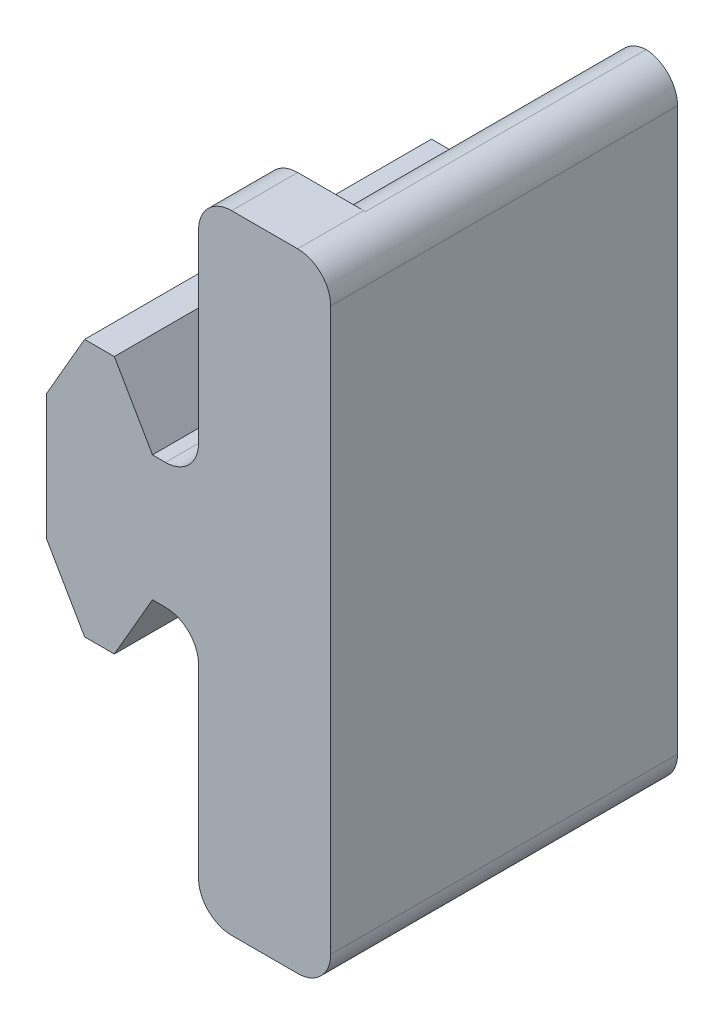
from build123d import *

# Parameters (mm, degrees)
SALIENTE_EXTRUIR1_DEPTH = 21
CROQUIS3_W              = 4.2
CROQUIS3_H              = 38
CORTAR_EXTRUIR1_DEPTH   = 17
REDONDEO1_R             = 2


with BuildPart() as part:
    # Croquis1 → Saliente-Extruir1 (new body)
    with BuildSketch(Plane(origin=(0, 0, 0), x_dir=(0, 1, 0), z_dir=(0, 0, 1))):
        Polygon((-3.8, 9.209401077), (3.8, 9.209401077), (7.8, 6.9), (7.8, 5.1), (3.8, 2.790598923), (3.8, 0), (19, 0), (19, -8), (-19, -8), (-19, 0), (-3.8, 0), (-3.8, 2.790598923), (-7.8, 5.1), (-7.8, 6.9), align=None)
    extrude(amount=SALIENTE_EXTRUIR1_DEPTH)

    # Croquis3 → Cortar-Extruir1 (cut)
    with BuildSketch(Plane(origin=(0, 0, 0), x_dir=(1, 0, 0), z_dir=(0, 0, -1))):
        with Locations((2.1, 0)):
            Rectangle(CROQUIS3_W, CROQUIS3_H)
    extrude(amount=-CORTAR_EXTRUIR1_DEPTH, mode=Mode.SUBTRACT)

    # Redondeo1
    # the kernel refuses this fillet: 2 mm, written as the material it adds along each edge
    with BuildSketch(Plane(origin=(0, -3.8, 17), x_dir=(-1, 0, 0), z_dir=(0, 0, 1))) as redondeo1_piece_1:
        with BuildLine():
            CenterArc((REDONDEO1_R, REDONDEO1_R), REDONDEO1_R, 180, 90)
            Line((0, REDONDEO1_R), (0, 0))
            Line((0, 0), (REDONDEO1_R, 0))
        make_face()
    extrude(amount=4)
    with BuildSketch(Plane(origin=(0, 3.8, 17), x_dir=(-1, 0, 0), z_dir=(0, 0, 1))) as redondeo1_piece_2:
        with BuildLine():
            CenterArc((REDONDEO1_R, -REDONDEO1_R), REDONDEO1_R, 90, 90)
            Line((0, -REDONDEO1_R), (0, 0))
            Line((0, 0), (REDONDEO1_R, 0))
        make_face()
    extrude(amount=4)
    # the kernel refuses this fillet: 2 mm, written as the material it takes off along each edge
    with BuildSketch(Plane(origin=(8, 19, -5), x_dir=(-1, 0, 0), z_dir=(0, 0, 1)), Plane(origin=(8, -19, -5), x_dir=(0, 1, 0), z_dir=(0, 0, 1))) as redondeo1_2_piece_1:
        with BuildLine():
            CenterArc((REDONDEO1_R, REDONDEO1_R), REDONDEO1_R, 180, 90)
            Line((0, REDONDEO1_R), (0, 0))
            Line((0, 0), (REDONDEO1_R, 0))
        make_face()
    extrude(amount=31, mode=Mode.SUBTRACT)
    with BuildSketch(Plane(origin=(4.2, -19, -5), x_dir=(1, 0, 0), z_dir=(0, 0, 1))) as redondeo1_2_piece_2:
        with BuildLine():
            CenterArc((REDONDEO1_R, REDONDEO1_R), REDONDEO1_R, 180, 90)
            Line((0, REDONDEO1_R), (0, 0))
            Line((0, 0), (REDONDEO1_R, 0))
        make_face()
    extrude(amount=22, mode=Mode.SUBTRACT)
    with BuildSketch(Plane(origin=(0, -19, 12), x_dir=(1, 0, 0), z_dir=(0, 0, 1)), Plane(origin=(0, 19, 12), x_dir=(0, -1, 0), z_dir=(0, 0, 1))) as redondeo1_2_piece_3:
        with BuildLine():
            CenterArc((REDONDEO1_R, REDONDEO1_R), REDONDEO1_R, 180, 90)
            Line((0, REDONDEO1_R), (0, 0))
            Line((0, 0), (REDONDEO1_R, 0))
        make_face()
    extrude(amount=14, mode=Mode.SUBTRACT)
    with BuildSketch(Plane(origin=(4.2, 19, -5), x_dir=(1, 0, 0), z_dir=(0, 0, 1))) as redondeo1_2_piece_4:
        with BuildLine():
            CenterArc((REDONDEO1_R, -REDONDEO1_R), REDONDEO1_R, 90, 90)
            Line((0, -REDONDEO1_R), (0, 0))
            Line((0, 0), (REDONDEO1_R, 0))
        make_face()
    extrude(amount=22, mode=Mode.SUBTRACT)


solid = part.part
